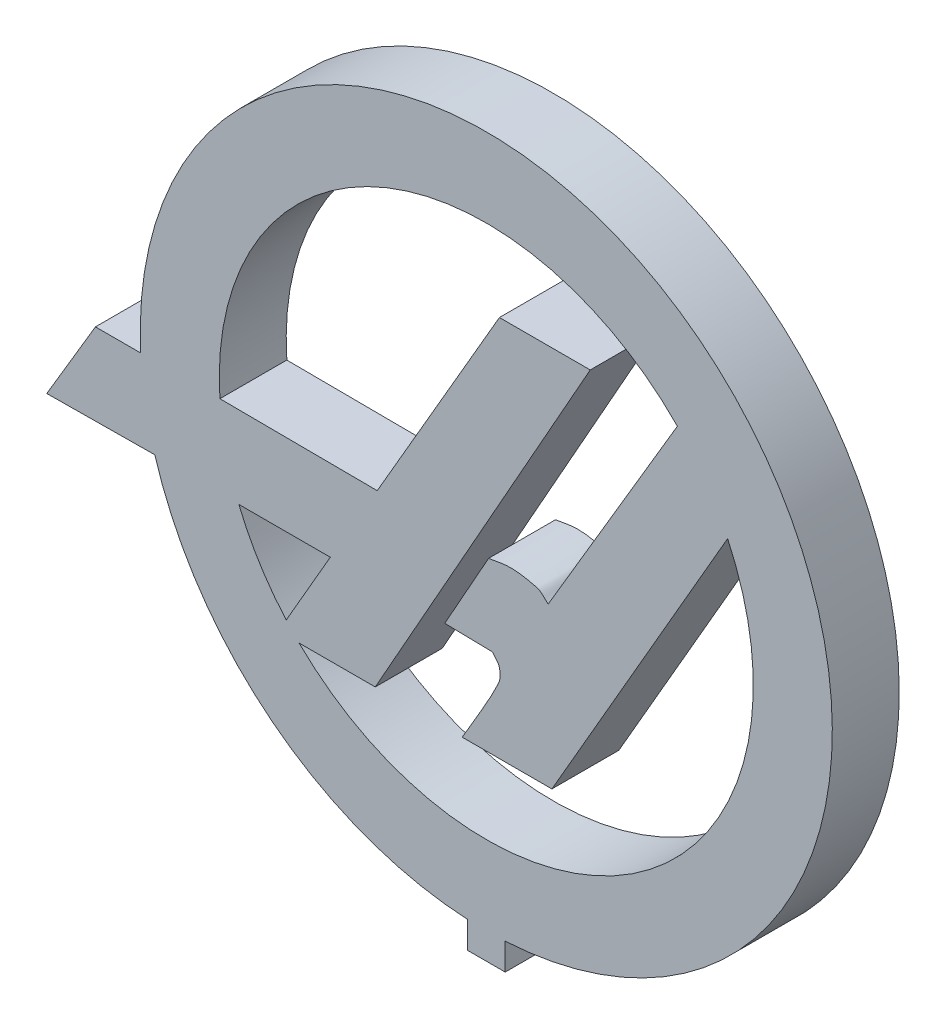
from build123d import *

# Parameters (mm, degrees)
BOSS_EXTRUDE1_DEPTH = 68.5
SCALE1_DEPTH        = 68.5
SCALE1_2_DEPTH      = 32.880047435
SCALE1_START        = 35.620047435
SCALE1_3_DEPTH      = 32.879952565
SCALE1_START_2      = 32.880047435
SCALE1_4_DEPTH      = 2.74


# Read off the part's stored shape, not the designer's step: Scale1
with BuildPart() as part:
    # Sketch1 → Boss-Extrude1 (new body)
    with BuildSketch(Plane.XY):
        with BuildLine():
            Line((6.806314099, 268.000000001), (117.455935844, 268.970996088))
            ThreePointArc((117.455935844, 268.970996088), (237.572521573, 92.54839531), (437.259031844, 17.194391779))
            Line((437.259031844, 17.194391779), (437.259031844, -10.223169449))
            Line((437.259031844, -10.223169449), (476.009031844, -10.223169449))
            Line((476.009031844, -10.223169449), (476.009031844, 17.194391779))
            ThreePointArc((476.009031844, 17.194391779), (693.184182798, 634.339249245), (103, 352))
            Line((103, 352), (56.640547879, 352))
            Line((56.640547879, 352), (6.806314099, 268.000000001))
        make_face()
        with BuildLine():
            ThreePointArc((251.884299831, 189.799453042), (224.339726467, 226.845833922), (203.423883848, 268.000000001))
            Line((203.423883848, 268.000000001), (297, 268.000000001))
            Line((297, 268.000000001), (251.884299831, 189.799453042))
        make_face(mode=Mode.SUBTRACT)
        with BuildLine():
            ThreePointArc((183.999999995, 352.000000012), (344.926101955, 620.204516968), (652.184505988, 561.696856288))
            Line((652.184505988, 561.696856288), (520, 338))
            add(Edge.make_bspline(
                [(520, 338), (516, 341), (512.856486558, 345.810656353), (508, 347), (483.294181497, 353.050404531), (477.851743634, 351.141957272), (459, 348)],
                knots=[0, 0, 0, 0, 1, 1, 1, 2, 2, 2, 2], degree=3))
            Line((459, 348), (414.15311107, 268.000000001))
            Line((414.15311107, 268.000000001), (463, 267))
            add(Edge.make_bspline(
                [(463, 267), (465.333333333, 263.666666667), (469.050440025, 260.956499894), (470, 257), (471.16945492, 252.127271165), (471.128314939, 246.536671316), (469, 242), (458.288028235, 219.166586501), (444.333333333, 198), (432, 176)],
                knots=[0, 0, 0, 0, 1, 1, 1, 2, 2, 2, 3, 3, 3, 3], degree=3))
            Line((432, 176), (523.783724069, 176))
            Line((523.783724069, 176), (703.607534398, 487.787583679))
            ThreePointArc((703.607534398, 487.787583679), (614.979125151, 148.065376335), (264.996930573, 175.96943637))
            Line((264.996930573, 175.96943637), (342.999405137, 176))
            Line((342.999405137, 176), (562.999999995, 567.000000012))
            Line((562.999999995, 567.000000012), (470.080751257, 567.000000012))
            Line((470.080751257, 567.000000012), (344.999999995, 351.000000012))
            Line((344.999999995, 351.000000012), (183.999999995, 352.000000012))
        make_face(mode=Mode.SUBTRACT)
    extrude(amount=BOSS_EXTRUDE1_DEPTH)

    # Scale1 outline → Scale1 (cut)
    # profile 1 of 3: a face of its own
    with BuildSketch(Plane.XY):
        with BuildLine():
            Line((56.640547879, 352), (6.806314099, 268.000000001))
            Line((6.806314099, 268.000000001), (117.455935844, 268.970996088))
            ThreePointArc((117.455935844, 268.970996088), (237.572521573, 92.54839531), (437.259031844, 17.194391779))
            Line((437.259031844, 17.194391779), (437.259031844, -10.223169449))
            Line((437.259031844, -10.223169449), (476.009031844, -10.223169449))
            Line((476.009031844, -10.223169449), (476.009031844, 17.194391779))
            ThreePointArc((476.009031844, 17.194391779), (693.184182798, 634.339249245), (103, 352))
            Line((103, 352), (56.640547879, 352))
        make_face()
        with BuildLine():
            Line((297, 268.000000001), (251.884299831, 189.799453042))
            ThreePointArc((251.884299831, 189.799453042), (224.339726467, 226.845833922), (203.423883848, 268.000000001))
            Line((203.423883848, 268.000000001), (297, 268.000000001))
        make_face(mode=Mode.SUBTRACT)
        with BuildLine():
            Line((342.999405137, 176), (440.459332473, 349.212402512))
            ThreePointArc((440.459332473, 349.212402512), (436.148252718, 352.738231864), (433.529545779, 357.653438395))
            Line((433.529545779, 357.653438395), (429.103560909, 357.614598551))
            Line((429.103560909, 357.614598551), (431.09693026, 360.974598551))
            Line((431.09693026, 360.974598551), (432.951308345, 360.974598551))
            ThreePointArc((432.951308345, 360.974598551), (439.774077465, 373.852337705), (454.347494733, 373.89538779))
            Line((454.347494733, 373.89538779), (562.999999995, 567.000000012))
            Line((562.999999995, 567.000000012), (470.080751257, 567.000000012))
            Line((470.080751257, 567.000000012), (344.999999995, 351.000000012))
            Line((344.999999995, 351.000000012), (183.999999995, 352.000000012))
            ThreePointArc((183.999999995, 352.000000012), (344.926101955, 620.204516968), (652.184505988, 561.696856288))
            Line((652.184505988, 561.696856288), (520, 338))
            add(Edge.make_bspline(
                [(520, 338), (516, 341), (512.856486558, 345.810656353), (508, 347), (483.294181497, 353.050404531), (477.851743634, 351.141957272), (459, 348)],
                knots=[0, 0, 0, 0, 1, 1, 1, 2, 2, 2, 2], degree=3))
            Line((459, 348), (414.15311107, 268.000000001))
            Line((414.15311107, 268.000000001), (463, 267))
            add(Edge.make_bspline(
                [(463, 267), (465.333333333, 263.666666667), (469.050440025, 260.956499894), (470, 257), (471.16945492, 252.127271165), (471.128314939, 246.536671316), (469, 242), (458.288028235, 219.166586501), (444.333333333, 198), (432, 176)],
                knots=[0, 0, 0, 0, 1, 1, 1, 2, 2, 2, 3, 3, 3, 3], degree=3))
            Line((432, 176), (523.783724069, 176))
            Line((523.783724069, 176), (703.607534398, 487.787583679))
            ThreePointArc((703.607534398, 487.787583679), (614.979125151, 148.065376335), (264.996930573, 175.96943637))
            Line((264.996930573, 175.96943637), (342.999405137, 176))
        make_face(mode=Mode.SUBTRACT)
    # profile 2 of 3: a face of its own
    with BuildSketch(Plane.XY):
        with BuildLine():
            ThreePointArc((436.968263699, 357.614598551), (437.804897404, 355.968431908), (438.906680338, 354.486576673))
            Line((438.906680338, 354.486576673), (440.711308345, 357.614598551))
            Line((440.711308345, 357.614598551), (436.968263699, 357.614598551))
        make_face()
    # profile 3 of 3: a face of its own
    with BuildSketch(Plane.XY):
        with BuildLine():
            ThreePointArc((439.431185568, 353.933376006), (440.667845198, 352.885534626), (442.04585661, 352.032080968))
            Line((442.04585661, 352.032080968), (452.760970596, 371.075709333))
            ThreePointArc((452.760970596, 371.075709333), (441.406740972, 371.060134505), (436.191308345, 360.974598552))
            Line((436.191308345, 360.974598552), (442.631308345, 360.934598552))
            Line((442.631308345, 360.934598552), (447.634538395, 369.574598552))
            Line((447.634538395, 369.574598552), (451.351308345, 369.574598552))
            Line((451.351308345, 369.574598552), (442.551284551, 353.934598551))
            Line((442.551284551, 353.934598551), (439.431185568, 353.933376006))
        make_face()
    extrude(amount=SCALE1_DEPTH, mode=Mode.SUBTRACT)

    # Scale1 2 outline → Scale1 2 (cut)
    with BuildSketch(Plane.XY):
        with BuildLine():
            Line((440.459332473, 349.212402512), (442.04585661, 352.032080968))
            ThreePointArc((442.04585661, 352.032080968), (440.667845198, 352.885534626), (439.431185568, 353.933376006))
            Line((439.431185568, 353.933376006), (442.551284551, 353.934598551))
            Line((442.551284551, 353.934598551), (451.351308345, 369.574598552))
            Line((451.351308345, 369.574598552), (447.634538395, 369.574598552))
            Line((447.634538395, 369.574598552), (442.631308345, 360.934598552))
            Line((442.631308345, 360.934598552), (436.191308345, 360.974598552))
            ThreePointArc((436.191308345, 360.974598552), (441.406740972, 371.060134505), (452.760970596, 371.075709333))
            Line((452.760970596, 371.075709333), (454.347494733, 373.89538779))
            ThreePointArc((454.347494733, 373.89538779), (439.774077465, 373.852337705), (432.951308345, 360.974598551))
            Line((432.951308345, 360.974598551), (431.09693026, 360.974598551))
            Line((431.09693026, 360.974598551), (429.103560909, 357.614598551))
            Line((429.103560909, 357.614598551), (433.529545779, 357.653438395))
            ThreePointArc((433.529545779, 357.653438395), (436.148252718, 352.738231864), (440.459332473, 349.212402512))
        make_face()
        with BuildLine():
            Line((440.711308345, 357.614598551), (438.906680338, 354.486576673))
            ThreePointArc((438.906680338, 354.486576673), (437.804897404, 355.968431908), (436.968263699, 357.614598551))
            Line((436.968263699, 357.614598551), (440.711308345, 357.614598551))
        make_face(mode=Mode.SUBTRACT)
    extrude(amount=SCALE1_2_DEPTH, mode=Mode.SUBTRACT)

    # Scale1 3 outline → Scale1 3 (cut)
    with BuildSketch(Plane.XY.offset(SCALE1_START)):
        with BuildLine():
            Line((440.459332473, 349.212402512), (442.04585661, 352.032080968))
            ThreePointArc((442.04585661, 352.032080968), (440.667845198, 352.885534626), (439.431185568, 353.933376006))
            Line((439.431185568, 353.933376006), (442.551284551, 353.934598551))
            Line((442.551284551, 353.934598551), (451.351308345, 369.574598552))
            Line((451.351308345, 369.574598552), (447.634538395, 369.574598552))
            Line((447.634538395, 369.574598552), (442.631308345, 360.934598552))
            Line((442.631308345, 360.934598552), (436.191308345, 360.974598552))
            ThreePointArc((436.191308345, 360.974598552), (441.406740972, 371.060134505), (452.760970596, 371.075709333))
            Line((452.760970596, 371.075709333), (454.347494733, 373.89538779))
            ThreePointArc((454.347494733, 373.89538779), (439.774077465, 373.852337705), (432.951308345, 360.974598551))
            Line((432.951308345, 360.974598551), (431.09693026, 360.974598551))
            Line((431.09693026, 360.974598551), (429.103560909, 357.614598551))
            Line((429.103560909, 357.614598551), (433.529545779, 357.653438395))
            ThreePointArc((433.529545779, 357.653438395), (436.148252718, 352.738231864), (440.459332473, 349.212402512))
        make_face()
        with BuildLine():
            Line((440.711308345, 357.614598551), (438.906680338, 354.486576673))
            ThreePointArc((438.906680338, 354.486576673), (437.804897404, 355.968431908), (436.968263699, 357.614598551))
            Line((436.968263699, 357.614598551), (440.711308345, 357.614598551))
        make_face(mode=Mode.SUBTRACT)
    extrude(amount=SCALE1_3_DEPTH, mode=Mode.SUBTRACT)

    # Scale1 4 outline → Scale1 4 (add)
    with BuildSketch(Plane.XY.offset(SCALE1_START_2)):
        with BuildLine():
            Line((445.397432788, 357.614598551), (447.351308345, 357.574598551))
            add(Edge.make_bspline(
                [(447.351308345, 357.574598551), (447.444641678, 357.441265218), (447.593325946, 357.332858547), (447.631308345, 357.174598551), (447.678086542, 356.979689398), (447.676440943, 356.756065404), (447.591308345, 356.574598551), (447.162829475, 355.661262011), (446.604641678, 354.814598551), (446.111308345, 353.934598551)],
                knots=[0, 0, 0, 0, 1, 1, 1, 2, 2, 2, 3, 3, 3, 3], degree=3))
            Line((446.111308345, 353.934598551), (449.782657308, 353.934598551))
            Line((449.782657308, 353.934598551), (456.975609721, 366.406101898))
            ThreePointArc((456.975609721, 366.406101898), (454.678280413, 353.851755114), (442.04585661, 352.032080968))
            Line((442.04585661, 352.032080968), (440.459332473, 349.212402512))
            ThreePointArc((440.459332473, 349.212402512), (443.301945183, 348.078900443), (446.321669619, 347.582374223))
            Line((446.321669619, 347.582374223), (446.321669619, 346.485671773))
            Line((446.321669619, 346.485671773), (447.871669619, 346.485671773))
            Line((447.871669619, 346.485671773), (447.871669619, 347.582374223))
            ThreePointArc((447.871669619, 347.582374223), (460.851564672, 358.341307853), (454.347494733, 373.89538779))
            Line((454.347494733, 373.89538779), (452.760970596, 371.075709333))
            ThreePointArc((452.760970596, 371.075709333), (453.894022137, 370.287343309), (454.918688585, 369.362472803))
            Line((454.918688585, 369.362472803), (449.631308345, 360.414598551))
            add(Edge.make_bspline(
                [(449.631308345, 360.414598551), (449.471308345, 360.534598551), (449.345567807, 360.727024805), (449.151308345, 360.774598551), (448.163075605, 361.016614733), (447.945378091, 360.940276842), (447.191308345, 360.814598551)],
                knots=[0, 0, 0, 0, 1, 1, 1, 2, 2, 2, 2], degree=3))
            Line((447.191308345, 360.814598551), (445.397432788, 357.614598551))
        make_face()
    extrude(amount=SCALE1_4_DEPTH)


solid = part.part
